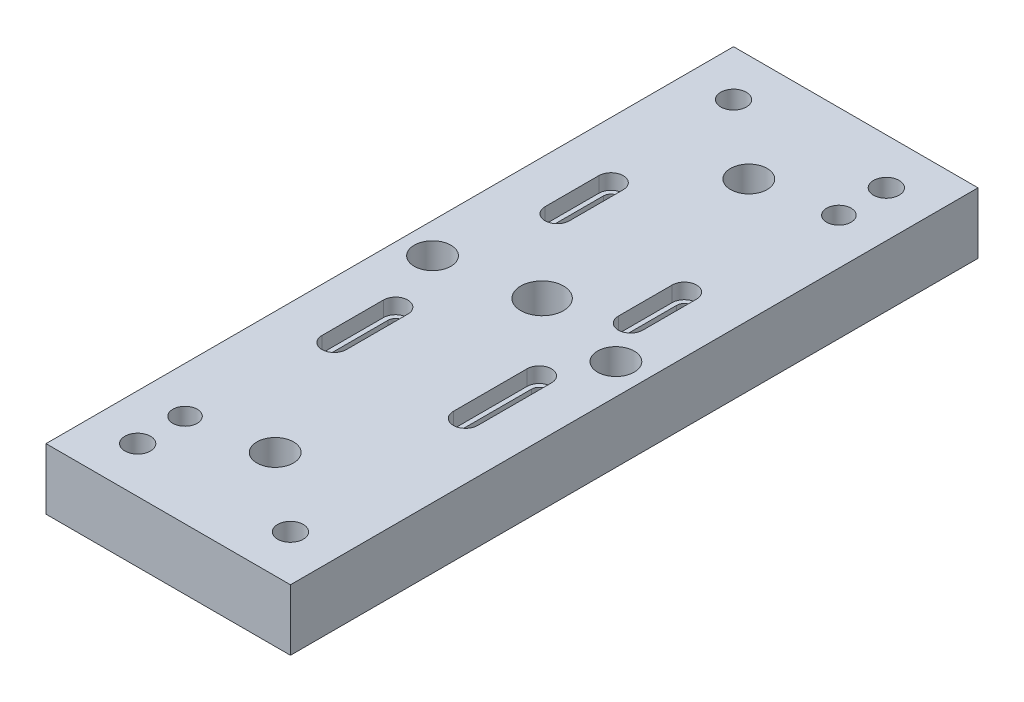
from build123d import *

# Parameters (mm, degrees)
SKETCH1_W                                    = 80
SKETCH1_H                                    = 225
BOSS_EXTRUDE1_DEPTH                          = 20
CUT_EXTRUDE1_REACH                           = 123.063
CUT_EXTRUDE2_DEPTH                           = 5
CBORE_FOR_M8_HEX_SOCKET_HEAD_CAP_SCR_2_COUNT = 2
CBORE_FOR_M8_HEX_SOCKET_HEAD_CAP_SCR_2_PITCH = 50
CBORE_FOR_M8_HEX_SOCKET_HEAD_CAP_SCR_3_COUNT = 2
CBORE_FOR_M8_HEX_SOCKET_HEAD_CAP_SCR_3_PITCH = 201.308221392
CBORE_FOR_M8_HEX_SOCKET_HEAD_CAP_SCR_4_COUNT = 2
CBORE_FOR_M8_HEX_SOCKET_HEAD_CAP_SCR_4_PITCH = 195
F_8_0MM_DOWEL_HOLE1_D                        = 8
SKETCH11_R                                   = 10.5
CUT_EXTRUDE3_DEPTH                           = 14.2
CUT_EXTRUDE4_REACH                           = 123.063
SKETCH13_R                                   = 6
CUT_EXTRUDE5_REACH                           = 123.063
SKETCH14_R                                   = 7


with BuildPart() as part:
    # Sketch1 → Boss-Extrude1 (new body)
    with BuildSketch(Plane(origin=(0, 0, 0), x_dir=(1, 0, 0), z_dir=(0, 1, 0))):
        Rectangle(SKETCH1_W, SKETCH1_H)
    extrude(amount=-BOSS_EXTRUDE1_DEPTH)

    # Sketch2 → Cut-Extrude1 (cut, up to next)
    with BuildSketch(Plane(origin=(0, 0, 0), x_dir=(1, 0, 0), z_dir=(0, 1, 0)), mode=Mode.PRIVATE) as cut_extrude1_sk1:
        with BuildLine():
            Line((24, 17.31), (24, 34.91))
            ThreePointArc((24, 34.91), (21.5, 37.41), (19, 34.91))
            Line((19, 34.91), (19, 17.31))
            ThreePointArc((19, 17.31), (21.5, 14.81), (24, 17.31))
        make_face()
    cut_extrude1_tool1 = extrude(cut_extrude1_sk1.sketch, amount=-CUT_EXTRUDE1_REACH, mode=Mode.PRIVATE) & part.part
    # Sketch2 → Cut-Extrude1 (cut, up to next)
    with BuildSketch(Plane(origin=(0, 0, 0), x_dir=(1, 0, 0), z_dir=(0, 1, 0)), mode=Mode.PRIVATE) as cut_extrude1_sk2:
        with BuildLine():
            Line((24, -36.69), (24, -12.59))
            ThreePointArc((24, -12.59), (21.5, -10.09), (19, -12.59))
            Line((19, -12.59), (19, -36.69))
            ThreePointArc((19, -36.69), (21.5, -39.19), (24, -36.69))
        make_face()
    cut_extrude1_tool2 = extrude(cut_extrude1_sk2.sketch, amount=-CUT_EXTRUDE1_REACH, mode=Mode.PRIVATE) & part.part
    # Sketch2 → Cut-Extrude1 (cut, up to next)
    with BuildSketch(Plane(origin=(0, 0, 0), x_dir=(1, 0, 0), z_dir=(0, 1, 0)), mode=Mode.PRIVATE) as cut_extrude1_sk3:
        with BuildLine():
            Line((-24, -16.59), (-24, -36.69))
            ThreePointArc((-24, -36.69), (-21.5, -39.19), (-19, -36.69))
            Line((-19, -36.69), (-19, -16.59))
            ThreePointArc((-19, -16.59), (-21.5, -14.09), (-24, -16.59))
        make_face()
    cut_extrude1_tool3 = extrude(cut_extrude1_sk3.sketch, amount=-CUT_EXTRUDE1_REACH, mode=Mode.PRIVATE) & part.part
    # Sketch2 → Cut-Extrude1 (cut, up to next)
    with BuildSketch(Plane(origin=(0, 0, 0), x_dir=(1, 0, 0), z_dir=(0, 1, 0)), mode=Mode.PRIVATE) as cut_extrude1_sk4:
        with BuildLine():
            Line((-24, 53.91), (-24, 36.31))
            ThreePointArc((-24, 36.31), (-21.5, 33.81), (-19, 36.31))
            Line((-19, 36.31), (-19, 53.91))
            ThreePointArc((-19, 53.91), (-21.5, 56.41), (-24, 53.91))
        make_face()
    cut_extrude1_tool4 = extrude(cut_extrude1_sk4.sketch, amount=-CUT_EXTRUDE1_REACH, mode=Mode.PRIVATE) & part.part
    add(cut_extrude1_tool1.solids().sort_by_distance((21.5, 0, -26.11))[0], mode=Mode.SUBTRACT)
    add(cut_extrude1_tool2.solids().sort_by_distance((21.5, 0, 24.64))[0], mode=Mode.SUBTRACT)
    add(cut_extrude1_tool3.solids().sort_by_distance((-21.5, 0, 26.64))[0], mode=Mode.SUBTRACT)
    add(cut_extrude1_tool4.solids().sort_by_distance((-21.5, 0, -45.11))[0], mode=Mode.SUBTRACT)

    # Sketch3 → Cut-Extrude2 (cut)
    with BuildSketch(Plane(origin=(0, 0, 0), x_dir=(1, 0, 0), z_dir=(0, 1, 0))):
        with BuildLine():
            Line((-17.5, 36.31), (-17.5, 53.91))
            ThreePointArc((-17.5, 53.91), (-21.5, 57.91), (-25.5, 53.91))
            Line((-25.5, 53.91), (-25.5, 36.31))
            ThreePointArc((-25.5, 36.31), (-21.5, 32.31), (-17.5, 36.31))
        make_face()
        with BuildLine():
            Line((25.5, 17.31), (25.5, 34.91))
            ThreePointArc((25.5, 34.91), (21.5, 38.91), (17.5, 34.91))
            Line((17.5, 34.91), (17.5, 17.31))
            ThreePointArc((17.5, 17.31), (21.5, 13.31), (25.5, 17.31))
        make_face()
        with BuildLine():
            Line((25.5, -36.69), (25.5, -12.59))
            ThreePointArc((25.5, -12.59), (21.5, -8.59), (17.5, -12.59))
            Line((17.5, -12.59), (17.5, -36.69))
            ThreePointArc((17.5, -36.69), (21.5, -40.69), (25.5, -36.69))
        make_face()
        with BuildLine():
            Line((-25.5, -16.59), (-25.5, -36.69))
            ThreePointArc((-25.5, -36.69), (-21.5, -40.69), (-17.5, -36.69))
            Line((-17.5, -36.69), (-17.5, -16.59))
            ThreePointArc((-17.5, -16.59), (-21.5, -12.59), (-25.5, -16.59))
        make_face()
    extrude(amount=-CUT_EXTRUDE2_DEPTH, mode=Mode.SUBTRACT)

    # Sketch6 → CBORE for M8 Hex Socket Head Cap Screw1 (revolve, cut)
    with BuildSketch(Plane(origin=(25, -20, -97.5), x_dir=(0, 0, -1), z_dir=(1, 0, 0))):
        Polygon((0, 0), (0, 20), (4.2, 20), (4.2, 8.6), (7.5, 8.6), (7.5, 0.025), (7.525, 0), align=None)
    cbore_for_m8_hex_socket_head_cap_screw1 = revolve(axis=Axis((25, -26.35, -97.5), (0, 1, 0)), mode=Mode.SUBTRACT)

    # CBORE for M8 Hex Socket Head Cap Scr 2: CBORE for M8 Hex Socket Head Cap Screw1 ×2
    with Locations(*[(-i * CBORE_FOR_M8_HEX_SOCKET_HEAD_CAP_SCR_2_PITCH, 0, 0) for i in range(1, CBORE_FOR_M8_HEX_SOCKET_HEAD_CAP_SCR_2_COUNT)]):
        add(cbore_for_m8_hex_socket_head_cap_screw1, mode=Mode.SUBTRACT)

    # CBORE for M8 Hex Socket Head Cap Scr 3: CBORE for M8 Hex Socket Head Cap Screw1 ×2
    with Locations(*[Vector(-0.24837535026770385, 0, 0.968663866044045) * (i * CBORE_FOR_M8_HEX_SOCKET_HEAD_CAP_SCR_3_PITCH) for i in range(1, CBORE_FOR_M8_HEX_SOCKET_HEAD_CAP_SCR_3_COUNT)]):
        add(cbore_for_m8_hex_socket_head_cap_screw1, mode=Mode.SUBTRACT)

    # CBORE for M8 Hex Socket Head Cap Scr 4: CBORE for M8 Hex Socket Head Cap Screw1 ×2
    with Locations(*[(0, 0, i * CBORE_FOR_M8_HEX_SOCKET_HEAD_CAP_SCR_4_PITCH) for i in range(1, CBORE_FOR_M8_HEX_SOCKET_HEAD_CAP_SCR_4_COUNT)]):
        add(cbore_for_m8_hex_socket_head_cap_screw1, mode=Mode.SUBTRACT)

    # Ø8.0mm Dowel Hole1 (through all)
    with Locations(Plane(origin=(0, -20, 0), x_dir=(-1, 0, 0), z_dir=(0, -1, 0))):
        with Locations((-25, 81.975), (25, -82)):
            Hole(F_8_0MM_DOWEL_HOLE1_D / 2)

    # Sketch11 → Cut-Extrude3 (cut)
    with BuildSketch(Plane.XZ.offset(20)):
        with Locations((-22, 55)):
            Circle(SKETCH11_R)
        with Locations((22, 55)):
            Circle(SKETCH11_R)
        with Locations((-22, -72)):
            Circle(SKETCH11_R)
        with Locations((22, -60)):
            Circle(SKETCH11_R)
        with Locations((0, -35)):
            Circle(SKETCH11_R)
        with Locations((0, 25)):
            Circle(SKETCH11_R)
    extrude(amount=-CUT_EXTRUDE3_DEPTH, mode=Mode.SUBTRACT)

    # Sketch13 → Cut-Extrude4 (cut, up to next)
    with BuildSketch(Plane(origin=(0, 0, 0), x_dir=(1, 0, 0), z_dir=(0, 1, 0)), mode=Mode.PRIVATE) as cut_extrude4_sk1:
        with Locations((0, 77.5)):
            Circle(SKETCH13_R)
    cut_extrude4_tool1 = extrude(cut_extrude4_sk1.sketch, amount=-CUT_EXTRUDE4_REACH, mode=Mode.PRIVATE) & part.part
    # Sketch13 → Cut-Extrude4 (cut, up to next)
    with BuildSketch(Plane(origin=(0, 0, 0), x_dir=(1, 0, 0), z_dir=(0, 1, 0)), mode=Mode.PRIVATE) as cut_extrude4_sk2:
        with Locations((0, -77.5)):
            Circle(SKETCH13_R)
    cut_extrude4_tool2 = extrude(cut_extrude4_sk2.sketch, amount=-CUT_EXTRUDE4_REACH, mode=Mode.PRIVATE) & part.part
    # Sketch13 → Cut-Extrude4 (cut, up to next)
    with BuildSketch(Plane(origin=(0, 0, 0), x_dir=(1, 0, 0), z_dir=(0, 1, 0)), mode=Mode.PRIVATE) as cut_extrude4_sk3:
        with Locations((-30, 4)):
            Circle(SKETCH13_R)
    cut_extrude4_tool3 = extrude(cut_extrude4_sk3.sketch, amount=-CUT_EXTRUDE4_REACH, mode=Mode.PRIVATE) & part.part
    # Sketch13 → Cut-Extrude4 (cut, up to next)
    with BuildSketch(Plane(origin=(0, 0, 0), x_dir=(1, 0, 0), z_dir=(0, 1, 0)), mode=Mode.PRIVATE) as cut_extrude4_sk4:
        with Locations((30, 4)):
            Circle(SKETCH13_R)
    cut_extrude4_tool4 = extrude(cut_extrude4_sk4.sketch, amount=-CUT_EXTRUDE4_REACH, mode=Mode.PRIVATE) & part.part
    add(cut_extrude4_tool1.solids().sort_by_distance((0, 0, -77.5))[0], mode=Mode.SUBTRACT)
    add(cut_extrude4_tool2.solids().sort_by_distance((0, 0, 77.5))[0], mode=Mode.SUBTRACT)
    add(cut_extrude4_tool3.solids().sort_by_distance((-30, 0, -4))[0], mode=Mode.SUBTRACT)
    add(cut_extrude4_tool4.solids().sort_by_distance((30, 0, -4))[0], mode=Mode.SUBTRACT)

    # Sketch14 → Cut-Extrude5 (cut, up to next)
    with BuildSketch(Plane(origin=(0, 0, 0), x_dir=(1, 0, 0), z_dir=(0, 1, 0)), mode=Mode.PRIVATE) as cut_extrude5_sk1:
        with Locations((0, 9.86)):
            Circle(SKETCH14_R)
    cut_extrude5_tool1 = extrude(cut_extrude5_sk1.sketch, amount=-CUT_EXTRUDE5_REACH, mode=Mode.PRIVATE) & part.part
    add(cut_extrude5_tool1.solids().sort_by_distance((0, 0, -9.86))[0], mode=Mode.SUBTRACT)


solid = part.part
